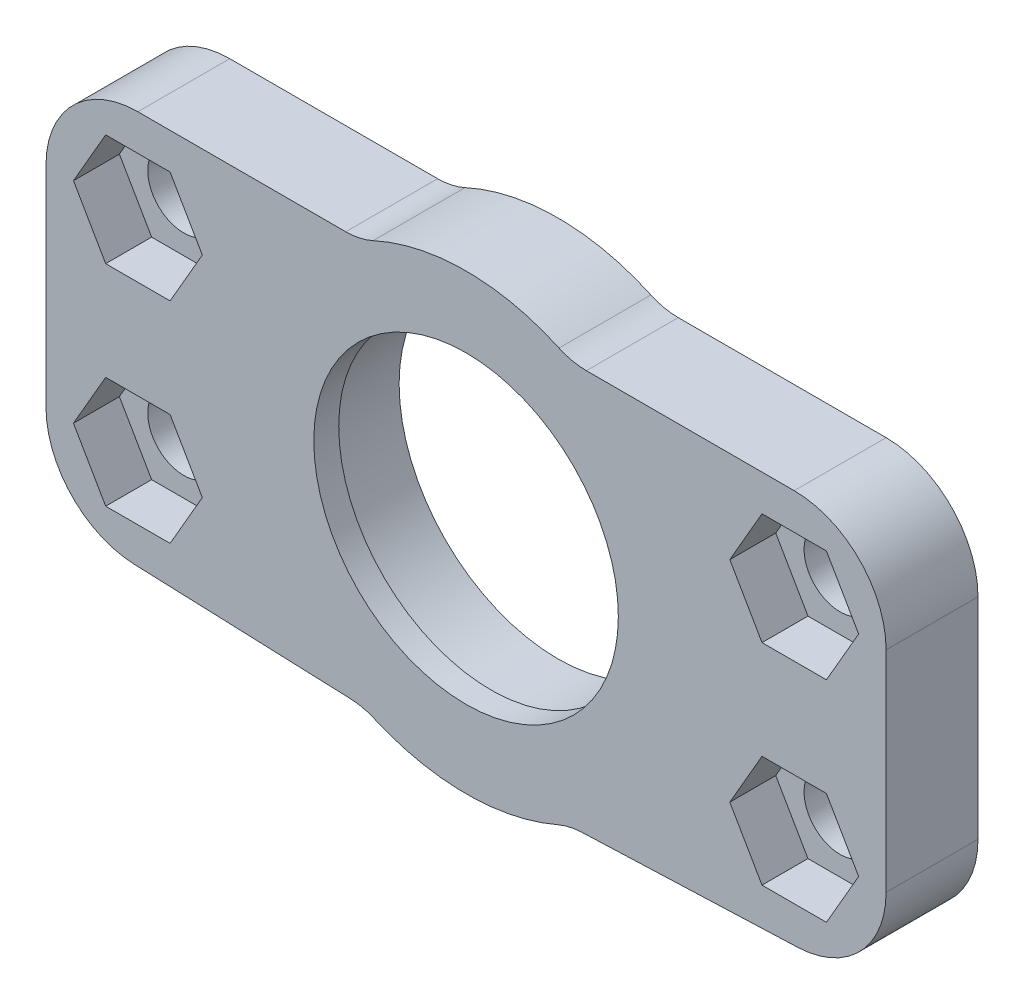
from build123d import *

# Parameters (mm, degrees)
SKETCH1_R           = 2.75
BOSS_EXTRUDE1_DEPTH = 3.5
SKETCH2_R           = 12.1
CUT_EXTRUDE1_DEPTH  = 5.1
CUT_EXTRUDE2_DEPTH  = 3.5
FILLET1_R           = 5


with BuildPart() as part:
    # Sketch1 → Boss-Extrude1 (new, symmetric)
    with BuildSketch(Plane.XY):
        with BuildLine():
            Line((-8, 15), (-25, 15))
            ThreePointArc((-25, 15), (-29.949747468, 12.949747468), (-32, 8))
            Line((-32, 8), (-32, -8))
            ThreePointArc((-32, -8), (-30.043857782, -12.853812798), (-25.268714664, -14.994840415))
            Line((-25.268714664, -14.994840415), (-7.79923083, -15.665950289))
            ThreePointArc((-7.79923083, -15.665950289), (-4.00598739, -17.035318166), (0, -17.5))
            Line((0, -17.5), (0, -11.6))
            ThreePointArc((0, -11.6), (-11.6, 0), (0, 11.6))
            Line((0, 11.6), (0, 17))
            ThreePointArc((0, 17), (-4.123105626, 16.492422502), (-8, 15))
        make_face()
        with Locations((-25, 8)):
            Circle(SKETCH1_R, mode=Mode.SUBTRACT)
        with Locations((-25, -8)):
            Circle(SKETCH1_R, mode=Mode.SUBTRACT)
    extrude(amount=BOSS_EXTRUDE1_DEPTH, both=True)

    # Sketch2 → Cut-Extrude1 (cut)
    with BuildSketch(Plane(origin=(0, 0, -3.5), x_dir=(-1, 0, 0), z_dir=(0, 0, -1))):
        Circle(SKETCH2_R)
    extrude(amount=-CUT_EXTRUDE1_DEPTH, mode=Mode.SUBTRACT)

    # Sketch3 → Cut-Extrude2 (cut)
    with BuildSketch(Plane.XY.offset(3.5)):
        Polygon((-27.453738644, 12.25), (-29.907477288, 8), (-27.453738644, 3.75), (-22.546261356, 3.75), (-20.092522712, 8), (-22.546261356, 12.25), align=None)
        Polygon((-27.453738644, -3.75), (-29.907477288, -8), (-27.453738644, -12.25), (-22.546261356, -12.25), (-20.092522712, -8), (-22.546261356, -3.75), align=None)
    extrude(amount=-CUT_EXTRUDE2_DEPTH, mode=Mode.SUBTRACT)

    # Fillet1
    fillet1_edges = [part.edges().sort_by_distance(p)[0] for p in [
        (-7.79923083, -15.665950289, 0),
        (-8, 15, 0),
    ]]
    fillet(fillet1_edges, radius=FILLET1_R)

    # Mirror1: part across plane


with BuildPart() as part_1:
    add(part.part)
    add(part.part.mirror(Plane(origin=(0, 17, 3.5), x_dir=(0, 0, 1), z_dir=(-1, 0, 0))))


solid = part_1.part
